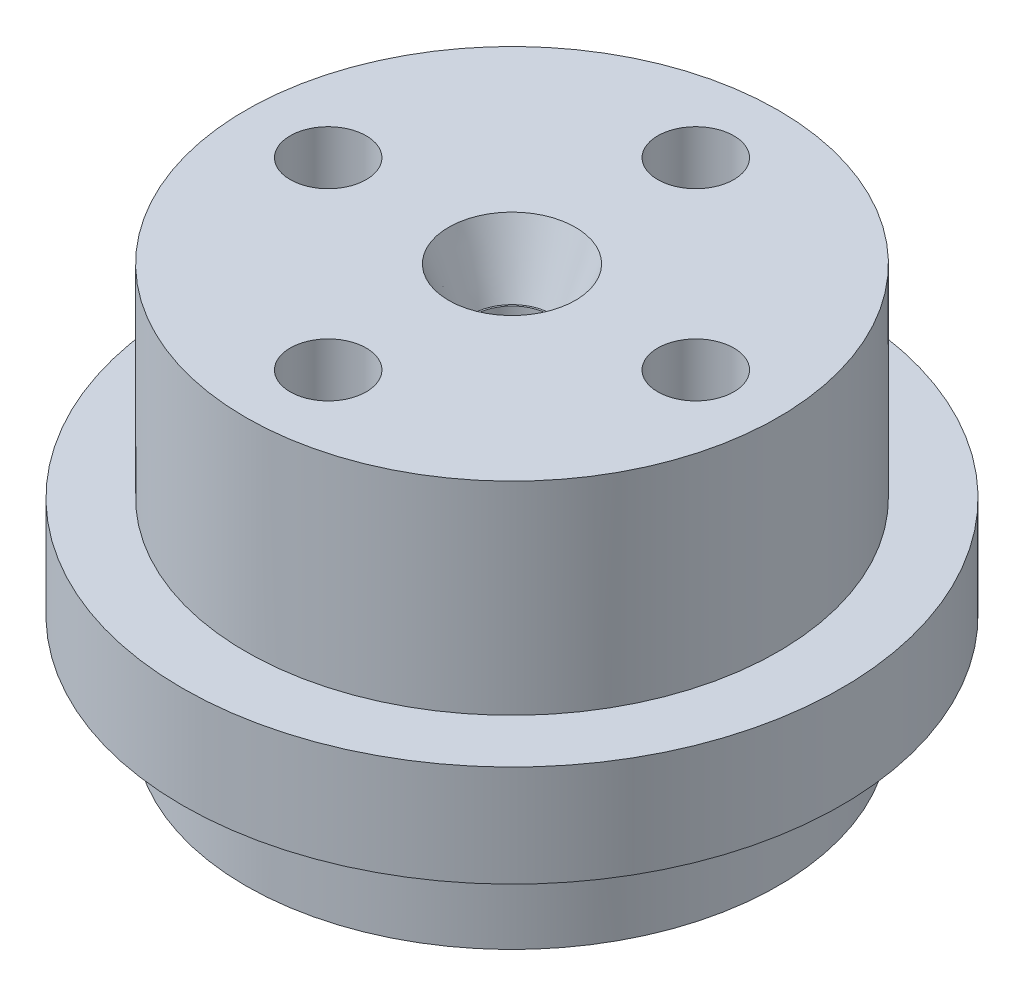
from build123d import *

# Parameters (mm, degrees)
SKETCH1_R                = 10.5
BOSS_EXTRUDE1_DEPTH      = 16
SKETCH2_R                = 1.5
CUT_EXTRUDE1_DEPTH       = 22.828879953
SKETCH3_R                = 2.5
CUT_EXTRUDE2_DEPTH       = 2.5
CUT_EXTRUDE2_DRAFT       = -20.5
BOSS_EXTRUDE2_DEPTH      = 2
BOSS_EXTRUDE2_DEPTH_BACK = 2
SKETCH5_R                = 13
SKETCH7_R                = 1.5
CUT_EXTRUDE3_DEPTH       = 10
SKETCH8_R                = 1
CUT_EXTRUDE4_DEPTH       = 21.928449536
SKETCH9_R                = 1.5
CUT_EXTRUDE5_DEPTH       = 25.372115214


with BuildPart() as part:
    # Sketch1 → Boss-Extrude1 (new body)
    with BuildSketch(Plane(origin=(0, 0, 0), x_dir=(1, 0, 0), z_dir=(0, 1, 0))):
        Circle(SKETCH1_R)
    extrude(amount=BOSS_EXTRUDE1_DEPTH)

    # Sketch2 → Cut-Extrude1 (cut, through all)
    with BuildSketch(Plane(origin=(0, 16, 0), x_dir=(1, 0, 0), z_dir=(0, 1, 0))):
        Circle(SKETCH2_R)
    extrude(amount=-CUT_EXTRUDE1_DEPTH, mode=Mode.SUBTRACT)


with BuildPart() as cut_extrude2_tool:
    # Sketch3 → Cut-Extrude2 (with draft: the straight prism first)
    with BuildSketch(Plane(origin=(0, 16, 0), x_dir=(1, 0, 0), z_dir=(0, 1, 0))):
        Circle(SKETCH3_R)
    extrude(amount=-CUT_EXTRUDE2_DEPTH)
    # Cut-Extrude2: the draft: its side faces are tilted about the plane it starts from
    cut_extrude2_sides = [cut_extrude2_tool.faces().sort_by_distance(p)[0] for p in [
        (-2.5, 14.75, 0),
    ]]
    draft(cut_extrude2_sides, Plane(origin=(0, 16, 0), x_dir=(1, 0, 0), z_dir=(0, 1, 0)), CUT_EXTRUDE2_DRAFT)


with BuildPart() as part_1:
    add(part.part)

    # Cut-Extrude2: cut by cut_extrude2_tool
    add(cut_extrude2_tool.part, mode=Mode.SUBTRACT)

    # Sketch5 → Boss-Extrude2 (add, two sides: drawn at the far end of the back side and taken through both)
    with BuildSketch(Plane(origin=(0, 6, 0), x_dir=(-1, 0, 0), z_dir=(0, -1, 0)).offset(-BOSS_EXTRUDE2_DEPTH_BACK)):
        Circle(SKETCH5_R)
    extrude(amount=BOSS_EXTRUDE2_DEPTH + BOSS_EXTRUDE2_DEPTH_BACK)

    # Sketch7 → Cut-Extrude3 (cut)
    with BuildSketch(Plane(origin=(0, 16, 0), x_dir=(1, 0, 0), z_dir=(0, 1, 0))):
        with Locations((0, 7.25)):
            Circle(SKETCH7_R)
        with Locations((7.25, 0)):
            Circle(SKETCH7_R)
        with Locations((0, -7.25)):
            Circle(SKETCH7_R)
        with Locations((-7.25, 0)):
            Circle(SKETCH7_R)
    extrude(amount=-CUT_EXTRUDE3_DEPTH, mode=Mode.SUBTRACT)

    # Sketch8 → Cut-Extrude4 (cut, through all)
    with BuildSketch(Plane(origin=(0, 6, 0), x_dir=(1, 0, 0), z_dir=(0, 1, 0))):
        with Locations((-7.25, 0)):
            Circle(SKETCH8_R)
        with Locations((0, 7.25)):
            Circle(SKETCH8_R)
        with Locations((7.25, 0)):
            Circle(SKETCH8_R)
        with Locations((0, -7.25)):
            Circle(SKETCH8_R)
    extrude(amount=-CUT_EXTRUDE4_DEPTH, mode=Mode.SUBTRACT)

    # Sketch9 → Cut-Extrude5 (cut, through all)
    with BuildSketch(Plane(origin=(0, 16, 0), x_dir=(1, 0, 0), z_dir=(0, 1, 0))):
        Circle(SKETCH9_R)
    extrude(amount=-CUT_EXTRUDE5_DEPTH, mode=Mode.SUBTRACT)


solid = part_1.part
